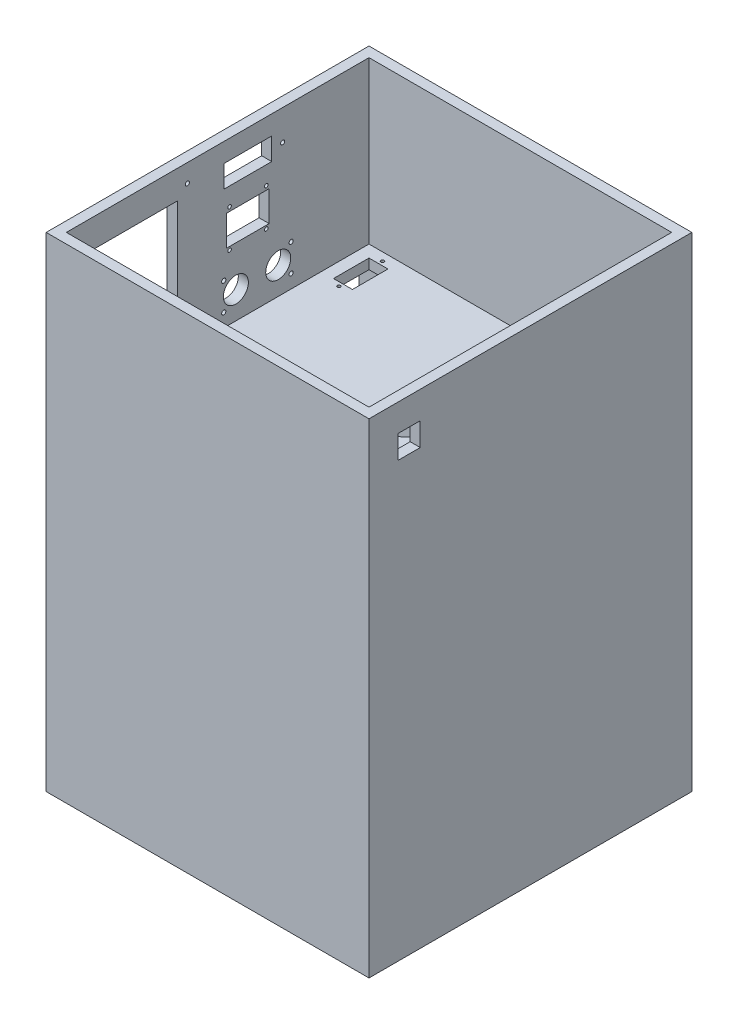
from build123d import *

# Parameters (mm, degrees)
SKETCH1_W           = 203.2
SKETCH1_H           = 203.2
BOSS_EXTRUDE1_DEPTH = 203.2
SHELL1_T            = -6.35
SKETCH4_W           = 203.2
SKETCH4_H           = 203.2
BOSS_EXTRUDE2_DEPTH = 101.6
SHELL2_START        = -95.25
SHELL2_OUTLINE_W    = 101.6
SHELL2_OUTLINE_H    = 190.5
SHELL2_DEPTH        = 190.5
CUT_EXTRUDE1_START  = -6.35
SKETCH5_R           = 7.874
SKETCH5_R_2         = 1.319970858
SKETCH5_R_3         = 1.143
SKETCH5_R_4         = 1.27
SKETCH5_W           = 26.67
SKETCH5_H           = 19.05
SKETCH5_W_2         = 29.972
SKETCH5_H_2         = 13.97
SKETCH5_W_3         = 63.5
SKETCH5_H_3         = 68.58
CUT_EXTRUDE1_DEPTH  = 6.35
SKETCH6_R           = 3.175
SKETCH6_R_2         = 2.0955
SKETCH6_R_3         = 1.016
SKETCH6_W           = 11.938
SKETCH6_H           = 22.352
CUT_EXTRUDE2_DEPTH  = 6.35
SKETCH8_R           = 3.354405652
CUT_EXTRUDE3_DEPTH  = 6.35
SKETCH9_W           = 14.019634769
SKETCH9_H           = 14.640004166
CUT_EXTRUDE4_DEPTH  = 6.35


# Read off the part's stored shape, not the designer's step: Shell2
with BuildPart() as part:
    # Sketch1 → Boss-Extrude1 (new body)
    with BuildSketch(Plane.XY):
        Rectangle(SKETCH1_W, SKETCH1_H)
    extrude(amount=BOSS_EXTRUDE1_DEPTH)

    # Shell1
    shell1_openings = [part.faces().sort_by_distance(p)[0] for p in [
        (-101.6, 0, 101.6),
    ]]
    offset(amount=SHELL1_T, openings=shell1_openings, kind=Kind.INTERSECTION)

    # Sketch4 → Boss-Extrude2 (add)
    with BuildSketch(Plane(origin=(0, 101.6, 0), x_dir=(1, 0, 0), z_dir=(0, 1, 0))):
        with Locations((0, -101.6)):
            Rectangle(SKETCH4_W, SKETCH4_H)
    extrude(amount=BOSS_EXTRUDE2_DEPTH)

    # Shell2 outline → Shell2 (cut)
    with BuildSketch(Plane.YZ.offset(SHELL2_START)):
        with Locations((152.4, 101.6)):
            Rectangle(SHELL2_OUTLINE_W, SHELL2_OUTLINE_H)
    extrude(amount=SHELL2_DEPTH, mode=Mode.SUBTRACT)

    # Sketch5 → Cut-Extrude1 (cut)
    with BuildSketch(Plane.ZY.offset(101.6).offset(CUT_EXTRUDE1_START)):
        with Locations((63.474447247, 118.667076397)):
            Circle(SKETCH5_R)
        with Locations((90.144447247, 118.667076397)):
            Circle(SKETCH5_R)
        with Locations((55.346447247, 127.295906985)):
            Circle(SKETCH5_R_2)
        with Locations((97.764447247, 127.295906985)):
            Circle(SKETCH5_R_2)
        with Locations((97.764447247, 110.023906985)):
            Circle(SKETCH5_R_2)
        with Locations((55.346447247, 110.023906985)):
            Circle(SKETCH5_R_2)
        with Locations((70.993, 165.762883725)):
            Circle(SKETCH5_R_3)
        with Locations((94.107, 165.762883725)):
            Circle(SKETCH5_R_3)
        with Locations((70.993, 142.140883725)):
            Circle(SKETCH5_R_3)
        with Locations((94.107, 142.140883725)):
            Circle(SKETCH5_R_3)
        with Locations((120.65, 191.77)):
            Circle(SKETCH5_R_4)
        with Locations((196.85, 191.77)):
            Circle(SKETCH5_R_4)
        with Locations((196.85, 109.22)):
            Circle(SKETCH5_R_4)
        with Locations((120.65, 109.22)):
            Circle(SKETCH5_R_4)
        with Locations((60.706, 184.15)):
            Circle(SKETCH5_R_4)
        with Locations((82.55, 153.697883725)):
            Rectangle(SKETCH5_W, SKETCH5_H)
        with Locations((82.55, 184.15)):
            Rectangle(SKETCH5_W_2, SKETCH5_H_2)
        with Locations((158.75, 151.13)):
            Rectangle(SKETCH5_W_3, SKETCH5_H_3)
    extrude(amount=CUT_EXTRUDE1_DEPTH, mode=Mode.SUBTRACT)

    # Sketch6 → Cut-Extrude2 (cut)
    with BuildSketch(Plane(origin=(0, 101.6, 0), x_dir=(1, 0, 0), z_dir=(0, 1, 0))):
        with Locations(Location((24.483185523, -126.083185523, 0), (0, 0, 270))):
            Circle(SKETCH6_R)
        with Locations(Location((11.783185523, -72.544814477, 0), (0, 0, 270))):
            Circle(SKETCH6_R_2)
        with Locations(Location((11.783185523, -107.342814477, 0), (0, 0, 270))):
            Circle(SKETCH6_R_2)
        with Locations(Location((-81.661, -11.43, 0), (0, 0, 270))):
            Circle(SKETCH6_R_3)
        with Locations(Location((-81.661, -38.862, 0), (0, 0, 270))):
            Circle(SKETCH6_R_3)
        with Locations(Location((-70.568433048, -131.129779716, 0), (0, 0, 270))):
            Circle(SKETCH6_R_3)
        with Locations(Location((-70.568433048, -158.561779716, 0), (0, 0, 270))):
            Circle(SKETCH6_R_3)
        with BuildLine():
            Line((11.783185523, -118.391814477), (11.783185523, -172.366814477))
            ThreePointArc((11.783185523, -172.366814477), (-19.807331819, -166.083069886), (-46.588479264, -148.188479264))
            Line((-46.588479264, -148.188479264), (-8.42239075, -110.02239075))
            ThreePointArc((-8.42239075, -110.02239075), (0.848006443, -116.216672119), (11.783185523, -118.391814477))
        make_face()
        with BuildLine():
            Line((22.723629252, -98.706814477), (29.563185523, -98.706814477))
            Line((29.563185523, -98.706814477), (29.563185523, -80.926814477))
            Line((29.563185523, -80.926814477), (22.723629252, -80.926814477))
            ThreePointArc((22.723629252, -80.926814477), (-2.313814477, -89.816814477), (22.723629252, -98.706814477))
        make_face()
        with Locations((-81.661, -25.146)):
            Rectangle(SKETCH6_W, SKETCH6_H)
        with Locations((-70.568433048, -144.845779716)):
            Rectangle(SKETCH6_W, SKETCH6_H)
    extrude(amount=-CUT_EXTRUDE2_DEPTH, mode=Mode.SUBTRACT)

    # Sketch8 → Cut-Extrude3 (cut)
    with BuildSketch(Plane.XZ.offset(101.6)):
        with Locations(Location((-89.493362178, 190.608444055, 0), (0, 0, 270))):
            Circle(SKETCH8_R)
        with Locations(Location((88.306637822, 190.608444055, 0), (0, 0, 270))):
            Circle(SKETCH8_R)
        with Locations(Location((88.306637822, 12.808444055, 0), (0, 0, 270))):
            Circle(SKETCH8_R)
        with Locations(Location((-89.493362178, 12.808444055, 0), (0, 0, 270))):
            Circle(SKETCH8_R)
    extrude(amount=-CUT_EXTRUDE3_DEPTH, mode=Mode.SUBTRACT)

    # Sketch9 → Cut-Extrude4 (cut)
    with BuildSketch(Plane(origin=(101.6, 0, 0), x_dir=(0, 0, -1), z_dir=(1, 0, 0))):
        with Locations((-177.956557016, 178.730851784)):
            Rectangle(SKETCH9_W, SKETCH9_H)
    extrude(amount=-CUT_EXTRUDE4_DEPTH, mode=Mode.SUBTRACT)


solid = part.part
